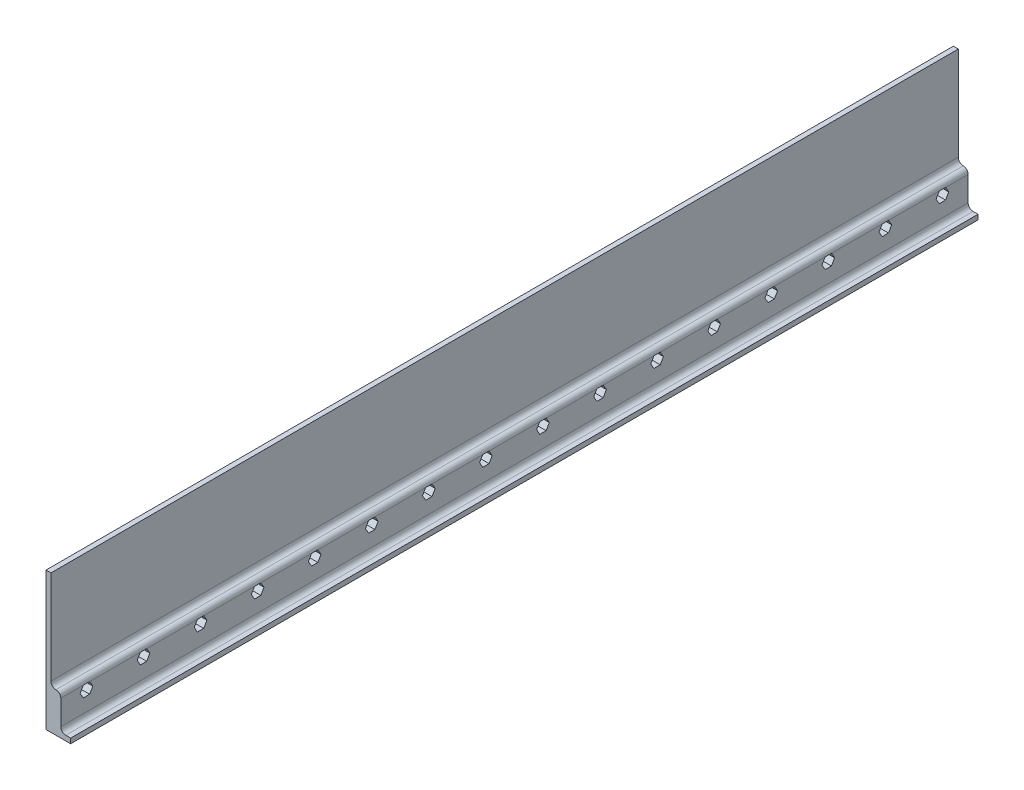
from build123d import *

# Parameters (mm, degrees)
GENERAL_EXTRUDE_DEPTH       = 459.76
ROUNDING_R                  = 5
ROLLER_HOLDERS_DEPTH        = 461.873363952
SKETCH5_W                   = 5
SKETCH5_H                   = 919.52
GUARD_RAIL_DEPTH            = 100
GUARD_RAIL_SUPPORT_FILLET_R = 5


with BuildPart() as part:
    # Sketch2 → General extrude (new, symmetric)
    with BuildSketch(Plane.XY):
        Polygon((-12.5, 20), (-12.5, -20), (12.5, -20), (12.5, -15), (2.5, -15), (2.5, 20), align=None)
    extrude(amount=GENERAL_EXTRUDE_DEPTH, both=True)

    # Rounding
    rounding_edges = [part.edges().sort_by_distance(p)[0] for p in [
        (2.5, 20, 0),
        (2.5, -15, 0),
    ]]
    fillet(rounding_edges, radius=ROUNDING_R)

    # Sketch3 → Roller holders (cut, through all)
    with BuildSketch(Plane.ZY.offset(12.5)):
        Polygon((436.967180745, 3.89), (440.174361491, 9.445), (436.967180745, 15), (430.552819255, 15), (427.345638509, 9.445), (430.552819255, 3.89), align=None)
        Polygon((379.137180745, 3.89), (382.344361491, 9.445), (379.137180745, 15), (372.722819255, 15), (369.515638509, 9.445), (372.722819255, 3.89), align=None)
        Polygon((321.307180745, 3.89), (324.514361491, 9.445), (321.307180745, 15), (314.892819255, 15), (311.685638509, 9.445), (314.892819255, 3.89), align=None)
        Polygon((263.477180745, 3.89), (266.684361491, 9.445), (263.477180745, 15), (257.062819255, 15), (253.855638509, 9.445), (257.062819255, 3.89), align=None)
        Polygon((205.647180745, 3.89), (208.854361491, 9.445), (205.647180745, 15), (199.232819255, 15), (196.025638509, 9.445), (199.232819255, 3.89), align=None)
        Polygon((147.817180745, 3.89), (151.024361491, 9.445), (147.817180745, 15), (141.402819255, 15), (138.195638509, 9.445), (141.402819255, 3.89), align=None)
        Polygon((89.987180745, 3.89), (93.194361491, 9.445), (89.987180745, 15), (83.572819255, 15), (80.365638509, 9.445), (83.572819255, 3.89), align=None)
        Polygon((32.157180745, 3.89), (35.364361491, 9.445), (32.157180745, 15), (25.742819255, 15), (22.535638509, 9.445), (25.742819255, 3.89), align=None)
        Polygon((-25.672819255, 3.89), (-22.465638509, 9.445), (-25.672819255, 15), (-32.087180745, 15), (-35.294361491, 9.445), (-32.087180745, 3.89), align=None)
        Polygon((-83.502819255, 3.89), (-80.295638509, 9.445), (-83.502819255, 15), (-89.917180745, 15), (-93.124361491, 9.445), (-89.917180745, 3.89), align=None)
        Polygon((-141.332819255, 3.89), (-138.125638509, 9.445), (-141.332819255, 15), (-147.747180745, 15), (-150.954361491, 9.445), (-147.747180745, 3.89), align=None)
        Polygon((-199.162819255, 3.89), (-195.955638509, 9.445), (-199.162819255, 15), (-205.577180745, 15), (-208.784361491, 9.445), (-205.577180745, 3.89), align=None)
        Polygon((-256.992819255, 3.89), (-253.785638509, 9.445), (-256.992819255, 15), (-263.407180745, 15), (-266.614361491, 9.445), (-263.407180745, 3.89), align=None)
        Polygon((-314.822819255, 3.89), (-311.615638509, 9.445), (-314.822819255, 15), (-321.237180745, 15), (-324.444361491, 9.445), (-321.237180745, 3.89), align=None)
        Polygon((-372.652819255, 3.89), (-369.445638509, 9.445), (-372.652819255, 15), (-379.067180745, 15), (-382.274361491, 9.445), (-379.067180745, 3.89), align=None)
        Polygon((-430.482819255, 3.89), (-427.275638509, 9.445), (-430.482819255, 15), (-436.897180745, 15), (-440.104361491, 9.445), (-436.897180745, 3.89), align=None)
    extrude(amount=-ROLLER_HOLDERS_DEPTH, mode=Mode.SUBTRACT)

    # Sketch5 → Guard rail (add)
    with BuildSketch(Plane(origin=(0, 20, 0), x_dir=(1, 0, 0), z_dir=(0, 1, 0))):
        with Locations((-10, 0)):
            Rectangle(SKETCH5_W, SKETCH5_H)
    extrude(amount=GUARD_RAIL_DEPTH)

    # Guard rail support fillet
    guard_rail_support_fillet_edges = [part.edges().sort_by_distance(p)[0] for p in [
        (-7.5, 20, 0),
    ]]
    fillet(guard_rail_support_fillet_edges, radius=GUARD_RAIL_SUPPORT_FILLET_R - 0.0001)  # a hair under: the kernel refuses the full size


solid = part.part
